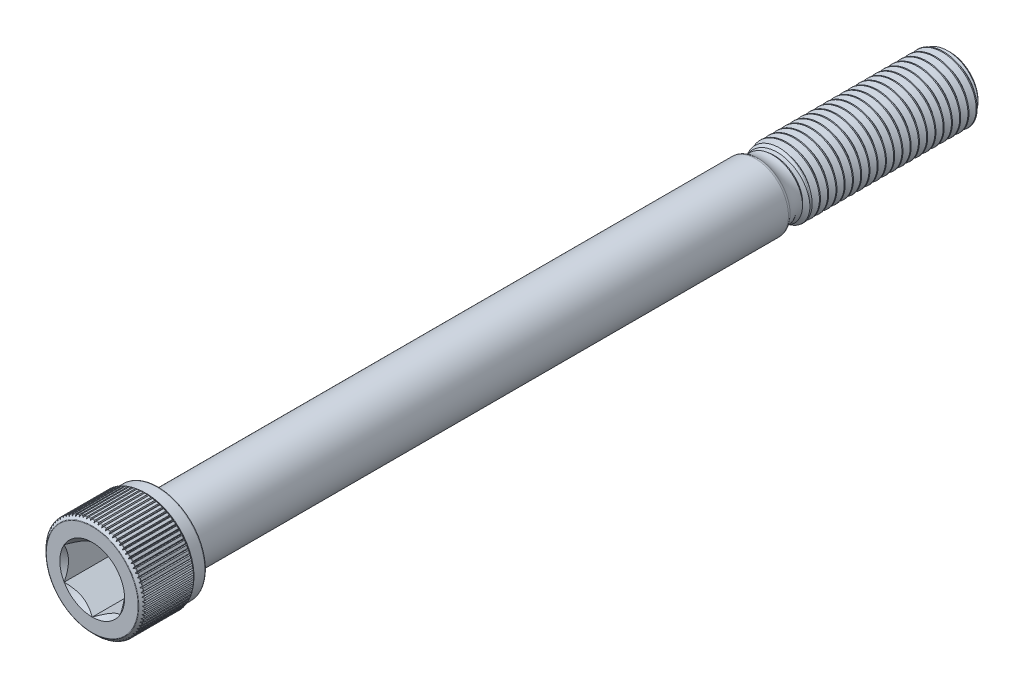
from build123d import *

# Parameters (mm, degrees)
CUT_EXTRUDE1_DEPTH     = 19
SKETCH12_R             = 5
FILLET2_R              = 1.25
SPLIT1_SURFACE_1_BACK  = 264.439
SPLIT1_SURFACE_1_DEPTH = 528.878
SPLIT1_SURFACE_2_BACK  = 264.439
SPLIT1_SURFACE_2_DEPTH = 528.878
CUT_SWEEP1_PITCH       = 2.5
CUT_SWEEP1_TO          = 55.307189
CUT_EXTRUDE3_DEPTH     = 261.863949315
CIRPATTERN1_COUNT      = 80


with BuildPart() as part:
    # Sketch2 → Revolve1 (revolve)
    with BuildSketch(Plane(origin=(0, 0, 0), x_dir=(0, 0, -1), z_dir=(1, 0, 0)), mode=Mode.PRIVATE) as revolve1_sk:
        with BuildLine():
            Line((-130, 0), (-130, 13.896446609))
            ThreePointArc((-130, 13.896446609), (-129.980969883, 13.992117467), (-129.926776695, 14.073223305))
            Line((-129.926776695, 14.073223305), (-129.073223305, 14.926776695))
            ThreePointArc((-129.073223305, 14.926776695), (-128.992117467, 14.980969883), (-128.896446609, 15))
            Line((-128.896446609, 15), (-114.353553391, 15))
            ThreePointArc((-114.353553391, 15), (-114.257882533, 14.980969883), (-114.176776695, 14.926776695))
            Line((-114.176776695, 14.926776695), (-113.823223305, 14.573223305))
            ThreePointArc((-113.823223305, 14.573223305), (-113.742117467, 14.519030117), (-113.646446609, 14.5))
            Line((-113.646446609, 14.5), (-110.375, 14.5))
            ThreePointArc((-110.375, 14.5), (-110.109834957, 14.390165043), (-110, 14.125))
            Line((-110, 14.125), (-110, 11))
            ThreePointArc((-110, 11), (-109.707106781, 10.292893219), (-109, 10))
            Line((-109, 10), (128.376202368, 10))
            Line((128.376202368, 10), (130, 8.376202368))
            Line((130, 8.376202368), (130, 0))
            Line((130, 0), (-130, 0))
        make_face()
    revolve(revolve1_sk.sketch.rotate(Axis((0, 0, -130), (0, 0, 1)), 90), axis=Axis((0, 0, -130), (0, 0, 1)))

    # Sketch3 → Cut-Extrude1 (cut)
    with BuildSketch(Plane.XY.offset(130)):
        Polygon((8.5, -4.907477288), (8.5, 4.907477288), (0, 9.814954576), (-8.5, 4.907477288), (-8.5, -4.907477288), (0, -9.814954576), align=None)
    extrude(amount=-CUT_EXTRUDE1_DEPTH, mode=Mode.SUBTRACT)

    # Cut-Extrude2 cone 1 section (through the dimple's axis) → Cut-Extrude2 (revolve, cut)
    with BuildSketch(Plane(origin=(0, 0, 130), x_dir=(0, -1, 0), z_dir=(1, 0, 0))):
        Polygon((0, 0), (9.814954576, 0), (0, 9.814954576), align=None)
    revolve(axis=Axis((0, 0, 130), (0, 0, -1)), mode=Mode.SUBTRACT)

    # Sketch12 → Cut-Revolve1 (revolve, cut)
    with BuildSketch(Plane(origin=(0, 0, 0), x_dir=(0, 0, -1), z_dir=(1, 0, 0)), mode=Mode.PRIVATE) as cut_revolve1_sk:
        with Locations((74.692810861, 13.75)):
            Circle(SKETCH12_R)
    revolve(cut_revolve1_sk.sketch.rotate(Axis((0, 0, 130), (0, 0, -1)), 270), axis=Axis((0, 0, 130), (0, 0, -1)), mode=Mode.SUBTRACT)

    # Fillet2
    fillet2_edges = [part.edges().sort_by_distance(p)[0] for p in [
        (10, 0, -71.385621722),
        (10, 0, -78),
    ]]
    fillet(fillet2_edges, radius=FILLET2_R)


with BuildPart() as body_2:
    # Split1: the piece behind the surface
    add(part.part)
    # Split1 surface: a surface, the sketch's curves swept straight by 528.878 mm
    with BuildLine(Plane(origin=(0, 0, 0), x_dir=(0, 0, -1), z_dir=(1, 0, 0)).offset(-SPLIT1_SURFACE_1_BACK), mode=Mode.PRIVATE) as split1_surface_1_path:
        Line((74.692810861, -10), (74.692810861, 10))
    split1_surface_1 = Shell.extrude(split1_surface_1_path.wire(), (1 * SPLIT1_SURFACE_1_DEPTH, 0 * SPLIT1_SURFACE_1_DEPTH, 0 * SPLIT1_SURFACE_1_DEPTH))
    split(bisect_by=split1_surface_1, keep=Keep.BOTTOM)

    # Cut-Sweep1: arcs per turn and ends read off the stored shape
    # Cut-Sweep1: the profile of Sketch7 screwed along a right-hand helix through 24.8 turns, 10 arcs to a turn; built about Z, then put on its axis
    cut_sweep1_z = Axis((0, 0, 0), (0, 0, 1))
    cut_sweep1_corners = [(10.135316469, 0, 0.078125), (10.135316469, 0, -2.265625), (8.376202368, 0, -1.25), (8.376202368, 0, -0.9375)]
    with BuildLine(mode=Mode.PRIVATE) as cut_sweep1_profile:
        Line(cut_sweep1_corners[0], cut_sweep1_corners[1])
        Line(cut_sweep1_corners[1], cut_sweep1_corners[2])
        Line(cut_sweep1_corners[2], cut_sweep1_corners[3])
        Line(cut_sweep1_corners[3], cut_sweep1_corners[0])
    cut_sweep1_cap = Face(cut_sweep1_profile.wire())
    cut_sweep1_turn_angles = [0, 18, 36, 54, 72, 90, 108, 126, 144, 162, 180, 198, 216, 234, 252, 270, 288, 306, 324, 342, 360]
    cut_sweep1_turn_weights = [1, 0.9510565162951535, 1, 0.9510565162951535, 1, 0.9510565162951535, 1, 0.9510565162951535, 1, 0.9510565162951535, 1, 0.9510565162951535, 1, 0.9510565162951535, 1, 0.9510565162951535, 1, 0.9510565162951535, 1, 0.9510565162951535, 1]
    cut_sweep1_turn_rails = [Edge.make_bspline([Vector(p[0], p[1], 0).rotate(cut_sweep1_z, cut_sweep1_turn_angles[k]) / cut_sweep1_turn_weights[k] + Vector(0, 0, p[2] + CUT_SWEEP1_PITCH * cut_sweep1_turn_angles[k] / 360) for k in range(21)], [0, 0, 0, 1, 1, 2, 2, 3, 3, 4, 4, 5, 5, 6, 6, 7, 7, 8, 8, 9, 9, 10, 10, 10], 2, cut_sweep1_turn_weights) for p in cut_sweep1_corners]
    cut_sweep1_turn_sides = [Face.make_surface_from_curves(cut_sweep1_turn_rails[p[0]], cut_sweep1_turn_rails[p[1]]) for p in [(0, 1), (1, 2), (2, 3), (3, 0)]]
    cut_sweep1_last_angles = [8640, 8658, 8676, 8694, 8712, 8730, 8748, 8766, 8784, 8802, 8820, 8838, 8856, 8874, 8892, 8910, 8928]
    cut_sweep1_last_weights = [1, 0.9510565162951535, 1, 0.9510565162951535, 1, 0.9510565162951535, 1, 0.9510565162951535, 1, 0.9510565162951535, 1, 0.9510565162951535, 1, 0.9510565162951535, 1, 0.9510565162949525, 1]
    cut_sweep1_last_rails = [Edge.make_bspline([Vector(p[0], p[1], 0).rotate(cut_sweep1_z, cut_sweep1_last_angles[k]) / cut_sweep1_last_weights[k] + Vector(0, 0, p[2] + CUT_SWEEP1_PITCH * cut_sweep1_last_angles[k] / 360) for k in range(17)], [0, 0, 0, 1, 1, 2, 2, 3, 3, 4, 4, 5, 5, 6, 6, 7, 7, 8, 8, 8], 2, cut_sweep1_last_weights) for p in cut_sweep1_corners]
    cut_sweep1_last_sides = [Face.make_surface_from_curves(cut_sweep1_last_rails[p[0]], cut_sweep1_last_rails[p[1]]) for p in [(0, 1), (1, 2), (2, 3), (3, 0)]]
    cut_sweep1 = Plane(origin=(0, 0, -130), x_dir=(0, 1, 0), z_dir=(0, 0, 1)) * split(Solid(Shell([*[p.moved(Location((0, 0, CUT_SWEEP1_PITCH * i))) for i in range(24) for p in cut_sweep1_turn_sides], *cut_sweep1_last_sides, cut_sweep1_cap, cut_sweep1_cap.rotate(cut_sweep1_z, 8928).moved(Location((0, 0, CUT_SWEEP1_PITCH * 8928 / 360)))])), bisect_by=Plane.XY.offset(CUT_SWEEP1_TO), keep=Keep.BOTTOM, mode=Mode.PRIVATE)
    add(cut_sweep1, mode=Mode.SUBTRACT)


with BuildPart() as part_1:
    add(part.part)

    # Split1: split by a surface, the side it looks to stays
    # Split1 surface: a surface, the sketch's curves swept straight by 528.878 mm
    with BuildLine(Plane(origin=(0, 0, 0), x_dir=(0, 0, -1), z_dir=(1, 0, 0)).offset(-SPLIT1_SURFACE_2_BACK), mode=Mode.PRIVATE) as split1_surface_2_path:
        Line((74.692810861, -10), (74.692810861, 10))
    split1_surface_2 = Shell.extrude(split1_surface_2_path.wire(), (1 * SPLIT1_SURFACE_2_DEPTH, 0 * SPLIT1_SURFACE_2_DEPTH, 0 * SPLIT1_SURFACE_2_DEPTH))
    split(bisect_by=split1_surface_2, keep=Keep.TOP)

    # Combine1: union body 2
    add(body_2.part)

    # Sketch9 → Cut-Extrude3 (cut, through all)
    with BuildSketch(Plane.XY.offset(130)):
        with BuildLine():
            Line((-0.068448994, 14.652838018), (-0.375, 15.33732796))
            Line((-0.375, 15.33732796), (0.375, 15.33732796))
            Line((0.375, 15.33732796), (0.068448994, 14.652838018))
            ThreePointArc((0.068448994, 14.652838018), (0, 14.608493118), (-0.068448994, 14.652838018))
        make_face()
    cut_extrude3 = extrude(amount=-CUT_EXTRUDE3_DEPTH, mode=Mode.SUBTRACT)

    # CirPattern1: Cut-Extrude3 ×80 about axis
    cirpattern1_axis = Axis((0, 0, 0), (0, 0, 1))
    for i in range(1, CIRPATTERN1_COUNT):
        add(cut_extrude3.rotate(cirpattern1_axis, i * 360 / CIRPATTERN1_COUNT), mode=Mode.SUBTRACT)


solid = part_1.part
